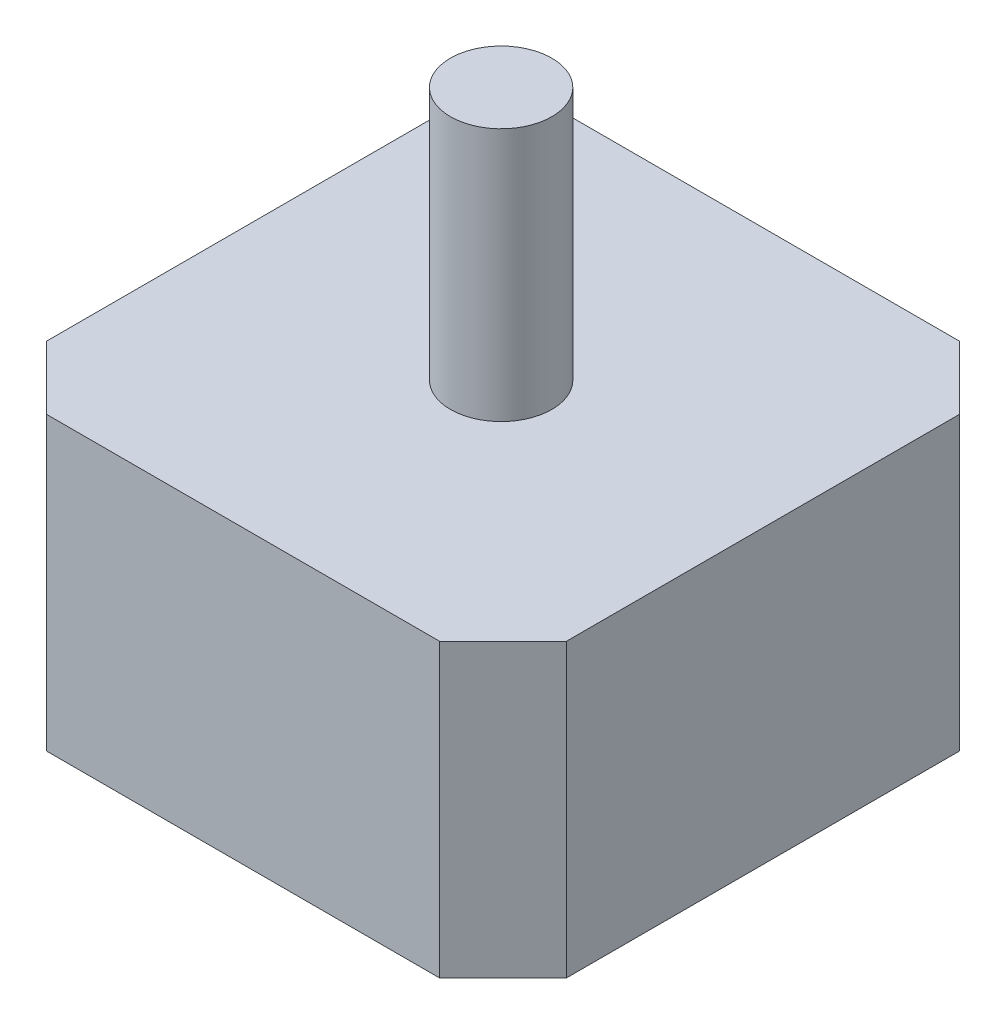
from build123d import *

# Parameters (mm, degrees)
BOSS_EXTRUDE7_DEPTH = 23
SKETCH5_R           = 4
BOSS_EXTRUDE8_DEPTH = 20
CUT_EXTRUDE1_DEPTH  = 23
CUT_EXTRUDE3_DEPTH  = 23
SKETCH8_W           = 14.993938253
SKETCH8_H           = 4.00275912
CUT_EXTRUDE4_DEPTH  = 14


with BuildPart() as part:
    # Sketch2 → Boss-Extrude7 (new body)
    with BuildSketch(Plane(origin=(0, 0, 0), x_dir=(1, 0, 0), z_dir=(0, 1, 0))):
        Polygon((-7.484687163, 20.5), (-20.5, 20.5), (-20.5, -20.5), (20.5, -20.5), (20.5, 20.5), (7.50925109, 20.5), (7.50925109, 24.50275912), (-7.484687163, 24.50275912), align=None)
    extrude(amount=BOSS_EXTRUDE7_DEPTH)

    # Sketch6 → Cut-Extrude1 (cut)
    with BuildSketch(Plane(origin=(0, 0, 0), x_dir=(1, 0, 0), z_dir=(0, 1, 0))):
        Polygon((-20.5, 20.5), (-15.5, 20.5), (-20.5, 15.5), align=None)
    extrude(amount=CUT_EXTRUDE1_DEPTH, mode=Mode.SUBTRACT)

    # Sketch7 → Cut-Extrude3 (cut)
    with BuildSketch(Plane(origin=(0, 0, 0), x_dir=(1, 0, 0), z_dir=(0, 1, 0))):
        Polygon((-20.5, -20.5), (-20.5, -15.5), (-15.5, -20.5), align=None)
        Polygon((20.5, -20.5), (15.5, -20.5), (20.5, -15.5), align=None)
        Polygon((20.5, 20.5), (20.5, 15.5), (15.5, 20.5), align=None)
    extrude(amount=CUT_EXTRUDE3_DEPTH, mode=Mode.SUBTRACT)

    # Sketch8 → Cut-Extrude4 (cut)
    with BuildSketch(Plane(origin=(0, 23, 0), x_dir=(1, 0, 0), z_dir=(0, 1, 0))):
        with Locations((0.012281963, 22.50137956)):
            Rectangle(SKETCH8_W, SKETCH8_H)
    extrude(amount=-CUT_EXTRUDE4_DEPTH, mode=Mode.SUBTRACT)


with BuildPart() as body_2:
    # Sketch5 → Boss-Extrude8 (new body)
    with BuildSketch(Plane(origin=(37.5, 23, -1.302287287), x_dir=(1, 0, 0), z_dir=(0, 1, 0))):
        with Locations((-37.404605427, -1.544526827)):
            Circle(SKETCH5_R)
    extrude(amount=BOSS_EXTRUDE8_DEPTH)


solid = Compound([part.part, body_2.part])
